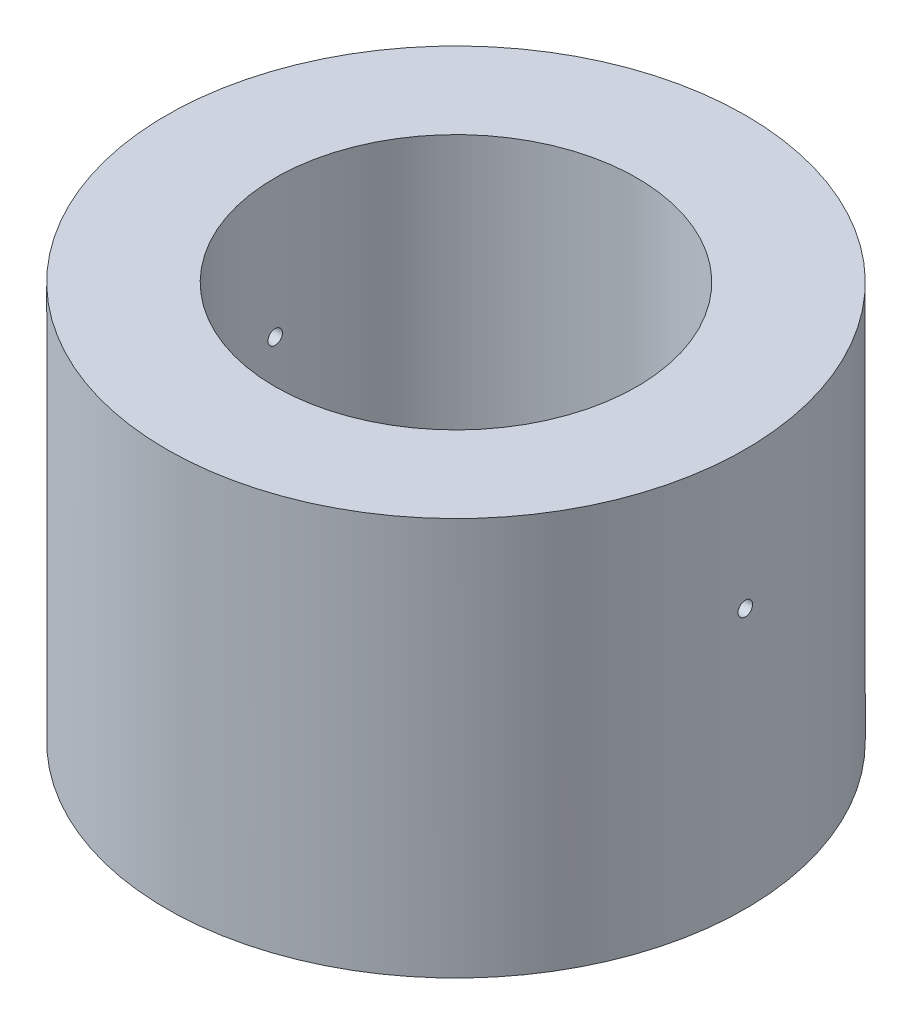
from build123d import *

# Parameters (mm, degrees)
SKETCH1_R               = 40
SKETCH1_R_2             = 25
BOSS_EXTRUDE1_DEPTH     = 50
CUT_EXTRUDE2_DEPTH      = 76.498344353
CUT_EXTRUDE2_DEPTH_BACK = 76.498344353
SKETCH3_R               = 1
BOSS_EXTRUDE2_START     = 5
SKETCH2_R               = 40
SKETCH2_R_2             = 37.5
BOSS_EXTRUDE2_DEPTH     = 5


with BuildPart() as part:
    # Sketch1 → Boss-Extrude1 (new body)
    with BuildSketch(Plane(origin=(0, 0, 0), x_dir=(1, 0, 0), z_dir=(0, 1, 0))):
        Circle(SKETCH1_R)
        Circle(SKETCH1_R_2, mode=Mode.SUBTRACT)
    extrude(amount=BOSS_EXTRUDE1_DEPTH)

    # Sketch3 → Cut-Extrude2 (cut, two sides: drawn at the far end of the back side and taken through both)
    with BuildSketch(Plane(origin=(0, 0, 0), x_dir=(0, 0, -1), z_dir=(1, 0, 0)).offset(-CUT_EXTRUDE2_DEPTH_BACK)):
        with Locations((0, 30.95)):
            Circle(SKETCH3_R)
    extrude(amount=CUT_EXTRUDE2_DEPTH + CUT_EXTRUDE2_DEPTH_BACK, mode=Mode.SUBTRACT)

    # Sketch2 → Boss-Extrude2 (add)
    with BuildSketch(Plane.XZ.offset(BOSS_EXTRUDE2_START)):
        Circle(SKETCH2_R)
        Circle(SKETCH2_R_2, mode=Mode.SUBTRACT)
    extrude(amount=-BOSS_EXTRUDE2_DEPTH)


solid = part.part
